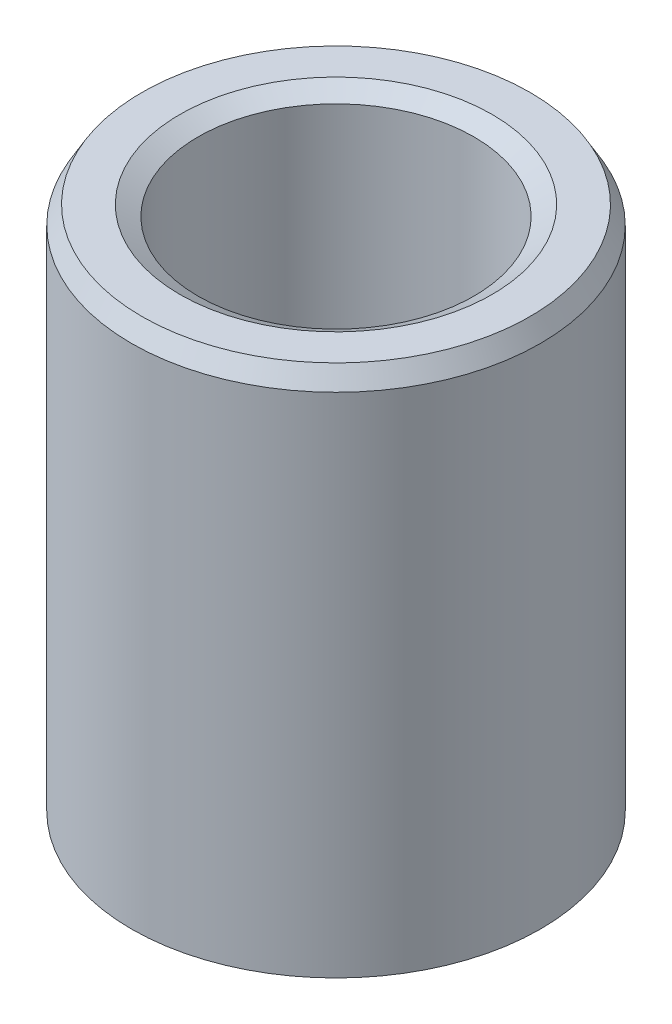
from build123d import *
from OCP.BRepFilletAPI import BRepFilletAPI_MakeChamfer

# Parameters (mm, degrees)
SKETCH1_R           = 17.5
BOSS_EXTRUDE1_DEPTH = 45.836856863
SKETCH2_R           = 11.806291012
CUT_EXTRUDE1_DEPTH  = 53.091433529
CHAMFER1_SIZE       = 1.545812116
CHAMFER1_SIZE2      = 0.892475041


with BuildPart() as part:
    # Sketch1 → Boss-Extrude1 (new body)
    with BuildSketch(Plane(origin=(0, 0, 0), x_dir=(1, 0, 0), z_dir=(0, 1, 0))):
        Circle(SKETCH1_R)
    extrude(amount=BOSS_EXTRUDE1_DEPTH)

    # Sketch2 → Cut-Extrude1 (cut, through all)
    with BuildSketch(Plane(origin=(0, 0, 0), x_dir=(1, 0, 0), z_dir=(0, 1, 0))):
        Circle(SKETCH2_R)
    extrude(amount=CUT_EXTRUDE1_DEPTH, mode=Mode.SUBTRACT)

    # Chamfer1: one chamfer whose edges measure the first distance from different faces: ONE call of the kernel's chamfer builder (chamfer() names one face for all edges)
    chamfer1_edges_1 = [part.edges().sort_by_distance(p)[0] for p in [
        (-11.806291012, 45.836856863, 0),
    ]]
    chamfer1_side_1 = [part.faces().sort_by_distance(p)[0] for p in [
        (-17.005025253, 45.836856863, 0),
    ]]
    chamfer1_edges_2 = [part.edges().sort_by_distance(p)[0] for p in [
        (-11.806291012, 0, 0),
    ]]
    chamfer1_side_2 = [part.faces().sort_by_distance(p)[0] for p in [
        (-11.806291012, 22.918428431, 0),
    ]]
    chamfer1_edges_3 = [part.edges().sort_by_distance(p)[0] for p in [
        (-17.5, 0, 0),
    ]]
    chamfer1_side_3 = [part.faces().sort_by_distance(p)[0] for p in [
        (-17.005025253, 0, 0),
    ]]
    chamfer1_edges_4 = [part.edges().sort_by_distance(p)[0] for p in [
        (-17.5, 45.836856863, 0),
    ]]
    chamfer1_side_4 = [part.faces().sort_by_distance(p)[0] for p in [
        (-17.5, 22.918428431, 0),
    ]]
    chamfer1 = BRepFilletAPI_MakeChamfer(part.part.solid().wrapped)
    for e in chamfer1_edges_1:
        chamfer1.Add(CHAMFER1_SIZE, CHAMFER1_SIZE2, e.wrapped, chamfer1_side_1[0].wrapped)  # the first distance lies on this face
    for e in chamfer1_edges_2:
        chamfer1.Add(CHAMFER1_SIZE, CHAMFER1_SIZE2, e.wrapped, chamfer1_side_2[0].wrapped)  # the first distance lies on this face
    for e in chamfer1_edges_3:
        chamfer1.Add(CHAMFER1_SIZE, CHAMFER1_SIZE2, e.wrapped, chamfer1_side_3[0].wrapped)  # the first distance lies on this face
    for e in chamfer1_edges_4:
        chamfer1.Add(CHAMFER1_SIZE, CHAMFER1_SIZE2, e.wrapped, chamfer1_side_4[0].wrapped)  # the first distance lies on this face
    add(Compound.cast(chamfer1.Shape()), mode=Mode.REPLACE)


solid = part.part
